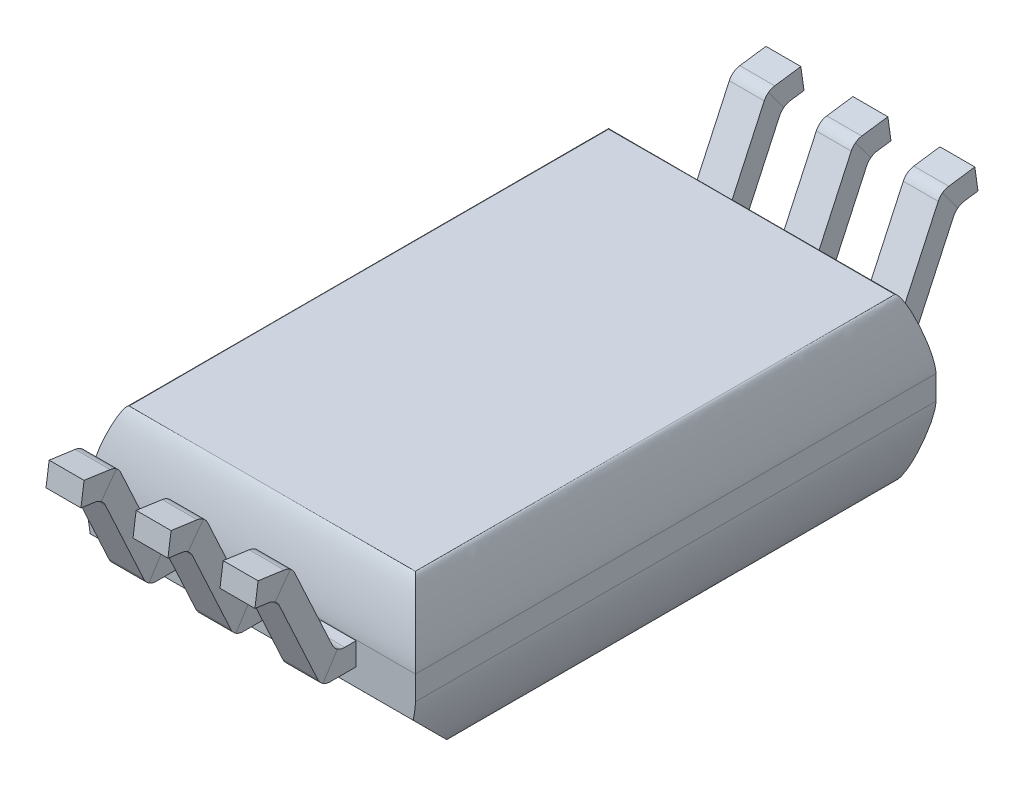
from build123d import *

# Parameters (mm, degrees)
BOSS_EXTRUDE1_DEPTH      = 2.39
BOSS_EXTRUDE1_DEPTH_BACK = 2.39
SKETCH2_W                = 7.6
SKETCH2_H                = 2.35
SKETCH13_W               = 0.51
SKETCH13_H               = 0.33
LPATTERN1_COUNT          = 2
LPATTERN1_PITCH          = 1.27
LPATTERN1_COL_COUNT      = 2
LPATTERN1_COL_PITCH      = 1.27
MIRROR1_COPY_1_SKETCH_W  = 0.51
MIRROR1_COPY_1_SKETCH_H  = 0.33
MIRROR1_COPY_2_SKETCH_W  = 0.51
MIRROR1_COPY_2_SKETCH_H  = 0.33
CHAMFER2_SIZE            = 0.75
FILLET4_SIZE             = 1
FILLET4_SIZE_2           = 0.3
FILLET5_SIZE             = 1
FILLET5_SIZE_2           = 0.3
SKETCH15_R               = 0.25
CUT_EXTRUDE1_DEPTH       = 0.1
FILLET6_R                = 0.2


with BuildPart() as part:
    # Sketch2 → Boss-Extrude1 (new, two sides: drawn at the far end of the back side and taken through both)
    with BuildSketch(Plane(origin=(0, 0, 0), x_dir=(0, 0, -1), z_dir=(1, 0, 0)).offset(-BOSS_EXTRUDE1_DEPTH_BACK)):
        with Locations((0, -1.475)):
            Rectangle(SKETCH2_W, SKETCH2_H)
    extrude(amount=BOSS_EXTRUDE1_DEPTH + BOSS_EXTRUDE1_DEPTH_BACK)

    # Sweep2: sweep along a path in Sketch11
    with BuildLine(Plane(origin=(0, 0, 0), x_dir=(0, 0, -1), z_dir=(1, 0, 0))) as sweep2_path:
        Line((3.8, -1.475), (4.2, -1.475))
        Line((4.2, -1.475), (4.855, -0.056216334))
        Line((4.855, -0.056216334), (5.255, 0))
    # Sketch13 → Sweep2 (sweep)
    with BuildSketch(Plane(origin=(0, 0, -3.8), x_dir=(-1, 0, 0), z_dir=(0, 0, -1))):
        with Locations((0, -1.475)):
            Rectangle(SKETCH13_W, SKETCH13_H)
    sweep2 = sweep(path=sweep2_path.line, transition=Transition.RIGHT)

    # LPattern1: Sweep2 ×2
    with Locations(*[(i * LPATTERN1_PITCH, 0, 0) for i in range(1, LPATTERN1_COUNT)]):
        add(sweep2)

    # LPattern1 col: Sweep2 ×2
    with Locations(*[(-i * LPATTERN1_COL_PITCH, 0, 0) for i in range(1, LPATTERN1_COL_COUNT)]):
        add(sweep2)

    # Mirror1: Sweep2 across plane
    add(sweep2.mirror(Plane.XY))

    # Mirror1 copy 1: sweep along a path in Mirror1 copy 1 path
    with BuildLine(Plane(origin=(1.27, 0, 0), x_dir=(0, 0, 1), z_dir=(1, 0, 0))) as mirror1_copy_1_path:
        Line((3.8, 1.475), (4.2, 1.475))
        Line((4.2, 1.475), (4.855, 0.056216334))
        Line((4.855, 0.056216334), (5.255, 0))
    # Mirror1 copy 1 sketch → Mirror1 copy 1 (sweep)
    with BuildSketch(Plane(origin=(1.27, 0, 3.8), x_dir=(-1, 0, 0), z_dir=(0, 0, 1))):
        with Locations((0, 1.475)):
            Rectangle(MIRROR1_COPY_1_SKETCH_W, MIRROR1_COPY_1_SKETCH_H)
    sweep(path=mirror1_copy_1_path.line, transition=Transition.RIGHT)

    # Mirror1 copy 2: sweep along a path in Mirror1 copy 2 path
    with BuildLine(Plane(origin=(-1.27, 0, 0), x_dir=(0, 0, 1), z_dir=(1, 0, 0))) as mirror1_copy_2_path:
        Line((3.8, 1.475), (4.2, 1.475))
        Line((4.2, 1.475), (4.855, 0.056216334))
        Line((4.855, 0.056216334), (5.255, 0))
    # Mirror1 copy 2 sketch → Mirror1 copy 2 (sweep)
    with BuildSketch(Plane(origin=(-1.27, 0, 3.8), x_dir=(-1, 0, 0), z_dir=(0, 0, 1))):
        with Locations((0, 1.475)):
            Rectangle(MIRROR1_COPY_2_SKETCH_W, MIRROR1_COPY_2_SKETCH_H)
    sweep(path=mirror1_copy_2_path.line, transition=Transition.RIGHT)

    # Chamfer2
    chamfer2_edges = [part.edges().sort_by_distance(p)[0] for p in [
        (0, -2.65, 3.8),
    ]]
    chamfer(chamfer2_edges, length=CHAMFER2_SIZE)

    # Fillet4
    # a fillet whose section is not a circle: 1, 0.3 mm, written as the material it takes off along each edge
    with BuildSketch(Plane(origin=(2.39, -0.3, 6.3), x_dir=(0, -1, 0), z_dir=(0, 0, -1))) as fillet4_piece_1:
        with BuildLine():
            Bezier((FILLET4_SIZE, 0), (0, 0), (0, FILLET4_SIZE_2), weights=[1, 0.25, 1])
            Line((0, FILLET4_SIZE_2), (0, 0))
            Line((0, 0), (FILLET4_SIZE, 0))
        make_face()
    extrude(amount=12.6, mode=Mode.SUBTRACT)
    with BuildSketch(Plane(origin=(4.89, -0.3, -3.8), x_dir=(0, -1, 0), z_dir=(-1, 0, 0)), Plane(origin=(-4.89, -0.3, 3.8), x_dir=(0, -1, 0), z_dir=(1, 0, 0))) as fillet4_piece_2:
        with BuildLine():
            Bezier((FILLET4_SIZE, 0), (0, 0), (0, FILLET4_SIZE_2), weights=[1, 0.25, 1])
            Line((0, FILLET4_SIZE_2), (0, 0))
            Line((0, 0), (FILLET4_SIZE, 0))
        make_face()
    extrude(amount=9.78, mode=Mode.SUBTRACT)
    with BuildSketch(Plane(origin=(-2.39, -0.3, 6.3), x_dir=(1, 0, 0), z_dir=(0, 0, -1))) as fillet4_piece_3:
        with BuildLine():
            Bezier((FILLET4_SIZE_2, 0), (0, 0), (0, FILLET4_SIZE), weights=[1, 0.25, 1])
            Line((0, FILLET4_SIZE), (0, 0))
            Line((0, 0), (FILLET4_SIZE_2, 0))
        make_face()
    extrude(amount=12.6, mode=Mode.SUBTRACT)

    # Fillet5
    # a fillet whose section is not a circle: 1, 0.3 mm, written as the material it takes off along each edge
    with BuildSketch(Plane(origin=(2.39, -2.65, -6.3), x_dir=(0, 1, 0), z_dir=(0, 0, 1))) as fillet5_piece_1:
        with BuildLine():
            Bezier((FILLET5_SIZE, 0), (0, 0), (0, FILLET5_SIZE_2), weights=[1, 0.25, 1])
            Line((0, FILLET5_SIZE_2), (0, 0))
            Line((0, 0), (FILLET5_SIZE, 0))
        make_face()
    extrude(amount=11.85, mode=Mode.SUBTRACT)
    with BuildSketch(Plane(origin=(4.89, -2.65, -3.8), x_dir=(0, 0, 1), z_dir=(-1, 0, 0))) as fillet5_piece_2:
        with BuildLine():
            Bezier((FILLET5_SIZE_2, 0), (0, 0), (0, FILLET5_SIZE), weights=[1, 0.25, 1])
            Line((0, FILLET5_SIZE), (0, 0))
            Line((0, 0), (FILLET5_SIZE_2, 0))
        make_face()
    extrude(amount=9.78, mode=Mode.SUBTRACT)
    with BuildSketch(Plane(origin=(-2.39, -2.65, -6.3), x_dir=(1, 0, 0), z_dir=(0, 0, 1))) as fillet5_piece_3:
        with BuildLine():
            Bezier((FILLET5_SIZE_2, 0), (0, 0), (0, FILLET5_SIZE), weights=[1, 0.25, 1])
            Line((0, FILLET5_SIZE), (0, 0))
            Line((0, 0), (FILLET5_SIZE_2, 0))
        make_face()
    extrude(amount=11.85, mode=Mode.SUBTRACT)

    # Sketch15 → Cut-Extrude1 (cut)
    with BuildSketch(Plane.XZ.offset(2.65)):
        with Locations(Location((1.59, 2.55, 0), (0, 0, 270))):
            Circle(SKETCH15_R)
    extrude(amount=-CUT_EXTRUDE1_DEPTH, mode=Mode.SUBTRACT)

    # Fillet6
    fillet6_edges = [part.edges().sort_by_distance(p)[0] for p in [
        (-1.27, 0.094652824, 4.74291591),
        (-1.27, -0.207085492, 4.96708409),
        (-1.27, -1.31, 4.094439598),
        (-1.27, -1.64, 4.305560402),
        (1.27, 0.094652824, 4.74291591),
        (1.27, -0.207085492, 4.96708409),
        (1.27, -1.31, 4.094439598),
        (1.27, -1.64, 4.305560402),
        (0, 0.094652824, -4.74291591),
        (0, -0.207085492, -4.96708409),
        (0, -1.31, -4.094439598),
        (0, -1.64, -4.305560402),
        (-1.27, 0.094652824, -4.74291591),
        (-1.27, -0.207085492, -4.96708409),
        (-1.27, -1.31, -4.094439598),
        (-1.27, -1.64, -4.305560402),
        (1.27, 0.094652824, -4.74291591),
        (1.27, -0.207085492, -4.96708409),
        (1.27, -1.31, -4.094439598),
        (1.27, -1.64, -4.305560402),
        (0, 0.094652824, 4.74291591),
        (0, -0.207085492, 4.96708409),
        (0, -1.31, 4.094439598),
        (0, -1.64, 4.305560402),
    ]]
    fillet(fillet6_edges, radius=FILLET6_R)


solid = part.part
